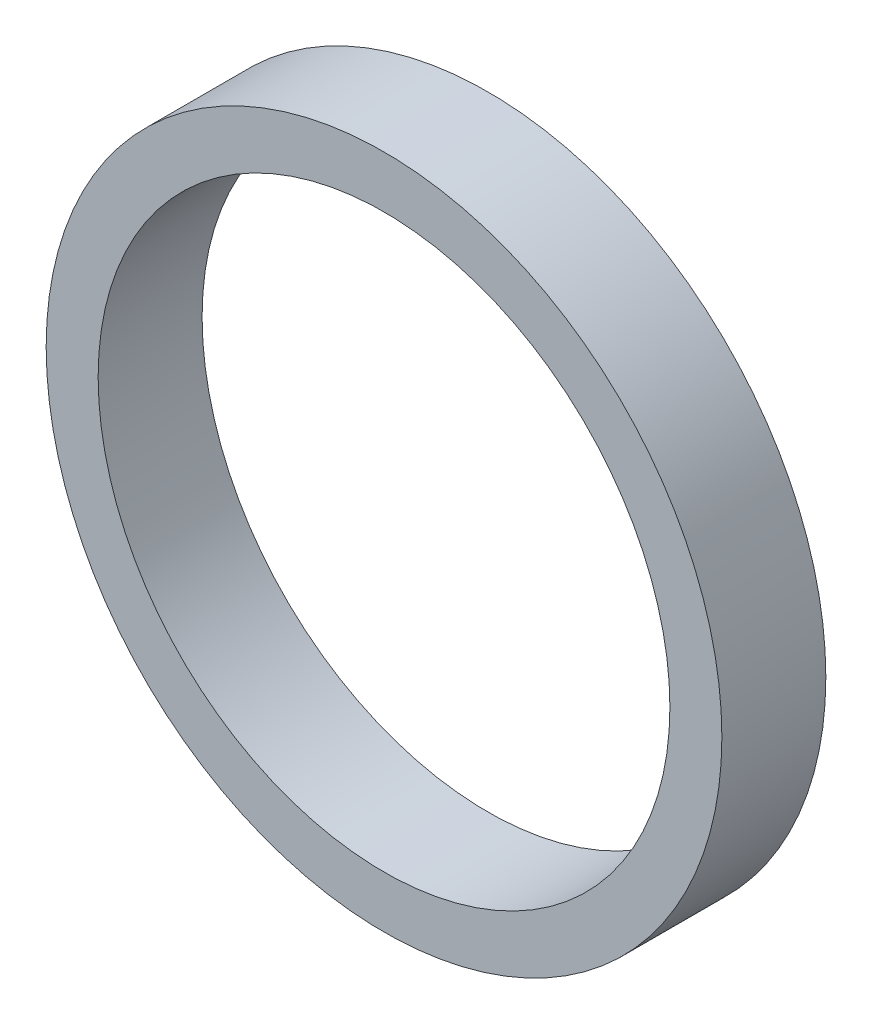
from build123d import *

# Parameters (mm, degrees)
EXTRUDE_1_DEPTH      = 5
EXTRUDE_1_DEPTH_BACK = 5
SKETCH_1_R           = 32.5
SKETCH_1_R_2         = 27.5


with BuildPart() as part:
    # Эскиз1 → Бобышка-Вытянуть1 (new, two sides: drawn at the far end of the back side and taken through both)
    with BuildSketch(Plane.XY.offset(-EXTRUDE_1_DEPTH_BACK)):
        Circle(SKETCH_1_R)
        Circle(SKETCH_1_R_2, mode=Mode.SUBTRACT)
    extrude(amount=EXTRUDE_1_DEPTH + EXTRUDE_1_DEPTH_BACK)


solid = part.part
